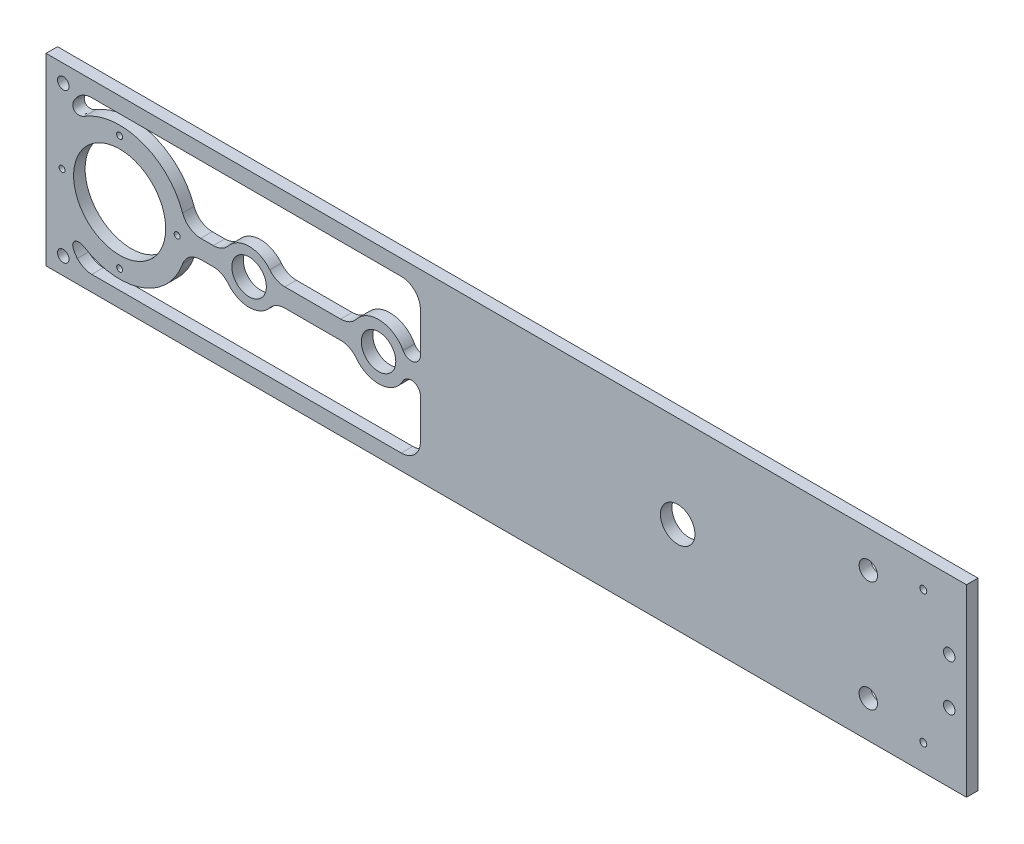
from build123d import *

# Parameters (mm, degrees)
SKETCH1_W           = 508
SKETCH1_H           = 101.6
BOSS_EXTRUDE1_DEPTH = 6.35
SKETCH2_R           = 25.4
SKETCH2_R_2         = 1.651
MOTOR_MOUNT_DEPTH   = 6.35
SKETCH3_R           = 9.525
SKETCH3_R_2         = 5.08
SKETCH3_R_3         = 1.905
CUT_EXTRUDE2_DEPTH  = 511.573170564
SKETCH4_R           = 3.175
CUT_EXTRUDE3_DEPTH  = 511.573170564
CUT_EXTRUDE4_DEPTH  = 511.573170564


with BuildPart() as part:
    # Sketch1 → Boss-Extrude1 (new body)
    with BuildSketch(Plane.XY):
        with Locations((254, 0)):
            Rectangle(SKETCH1_W, SKETCH1_H)
    extrude(amount=-BOSS_EXTRUDE1_DEPTH)

    # Sketch2 → Motor mount (cut)
    with BuildSketch(Plane.XY):
        with Locations((40.64, 0)):
            Circle(SKETCH2_R)
        with Locations((72.39, 0)):
            Circle(SKETCH2_R_2)
        with Locations((40.64, -31.75)):
            Circle(SKETCH2_R_2)
        with Locations((8.89, 0)):
            Circle(SKETCH2_R_2)
        with Locations((40.64, 31.75)):
            Circle(SKETCH2_R_2)
    extrude(amount=-MOTOR_MOUNT_DEPTH, mode=Mode.SUBTRACT)

    # Sketch3 → Cut-Extrude2 (cut, through all)
    with BuildSketch(Plane.XY):
        with Locations((112.0775, 0)):
            Circle(SKETCH3_R)
        with Locations((183.515, 0)):
            Circle(SKETCH3_R)
        with Locations((348.615, 0)):
            Circle(SKETCH3_R)
        with Locations((453.806353407, -30.582171978)):
            Circle(SKETCH3_R_2)
        with Locations((484.169453271, -36.573492277)):
            Circle(SKETCH3_R_3)
        with Locations((484.169453271, 36.573492277)):
            Circle(SKETCH3_R_3)
        with Locations((453.806353407, 30.582171978)):
            Circle(SKETCH3_R_2)
    extrude(amount=-CUT_EXTRUDE2_DEPTH, mode=Mode.SUBTRACT)

    # Sketch4 → Cut-Extrude3 (cut, through all)
    with BuildSketch(Plane.XY):
        with Locations((9.525, 41.275)):
            Circle(SKETCH4_R)
        with Locations((9.525, -41.275)):
            Circle(SKETCH4_R)
        with Locations((498.475, 12.7)):
            Circle(SKETCH4_R)
        with Locations((498.475, -12.7)):
            Circle(SKETCH4_R)
    extrude(amount=-CUT_EXTRUDE3_DEPTH, mode=Mode.SUBTRACT)

    # Sketch7 → Cut-Extrude4 (cut, through all)
    with BuildSketch(Plane.XY):
        with BuildLine():
            Line((85.406292789, 5.08), (92.341412089, 5.08))
            ThreePointArc((92.341412089, 5.08), (96.950572969, 6.134064693), (100.643442411, 9.08671294))
            ThreePointArc((100.643442411, 9.08671294), (112.0775, 14.605), (123.511557589, 9.08671294))
            ThreePointArc((123.511557589, 9.08671294), (127.204427031, 6.134064693), (131.813587911, 5.08))
            Line((131.813587911, 5.08), (162.585112959, 5.08))
            ThreePointArc((162.585112959, 5.08), (167.45975122, 6.214203951), (171.333000793, 9.383818205))
            ThreePointArc((171.333000793, 9.383818205), (184.777760897, 15.325227036), (197.068677539, 7.263261936))
            ThreePointArc((197.068677539, 7.263261936), (202.783248212, 4.735656121), (206.626270766, 9.662753319))
            Line((206.626270766, 9.662753319), (206.626270766, 31.603209647))
            ThreePointArc((206.626270766, 31.603209647), (203.520318205, 39.101642443), (196.02188541, 42.207595003))
            Line((196.02188541, 42.207595003), (25.263102588, 42.207595003))
            ThreePointArc((25.263102588, 42.207595003), (20.881723867, 41.260150637), (17.283250038, 38.587115578))
            add(Edge.make_bspline(
                [(17.283250038, 38.587115578), (11.530533455, 32.014027317), (16.787146308, 28.551640426), (21.263438452, 31.320883809)],
                knots=[0, 0, 0, 0, 1, 1, 1, 1], degree=3))
            ThreePointArc((21.263438452, 31.320883809), (52.918543043, 34.722993545), (75.39838363, 12.177999321))
            ThreePointArc((75.39838363, 12.177999321), (79.271558889, 7.034643814), (85.406292789, 5.08))
        make_face()
    cut_extrude4 = extrude(amount=-CUT_EXTRUDE4_DEPTH, mode=Mode.SUBTRACT)

    # Mirror1: Cut-Extrude4 across plane
    add(cut_extrude4.mirror(Plane.ZX), mode=Mode.SUBTRACT)


solid = part.part
